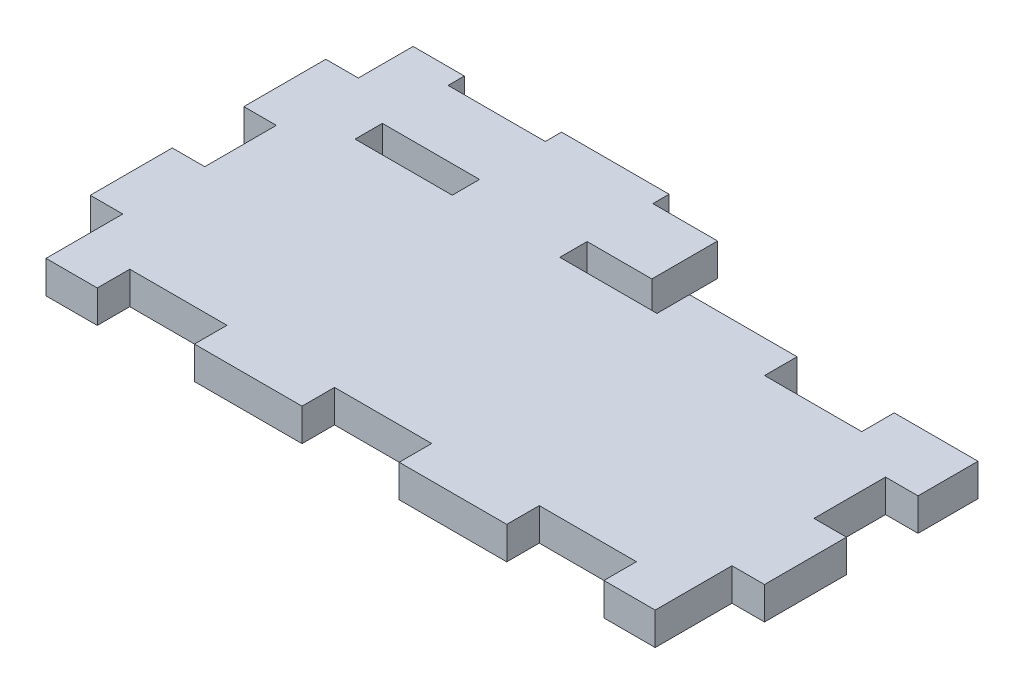
from build123d import *

# Parameters (mm, degrees)
SKETCH1_W           = 65.35
SKETCH1_H           = 35.35
BOSS_EXTRUDE1_DEPTH = 3.175
SKETCH2_W           = 28.175
SKETCH2_H           = 7.5
CUT_EXTRUDE1_DEPTH  = 75.366159138
SKETCH3_W           = 3.175
SKETCH3_H           = 7.5
SKETCH3_W_2         = 10
SKETCH3_H_2         = 3.175
SKETCH3_H_3         = 1.5875
SKETCH3_H_4         = 5.35
CUT_EXTRUDE2_DEPTH  = 3.175
SKETCH6_W           = 9.492
SKETCH6_H           = 2.667
BOSS_EXTRUDE2_DEPTH = 3.175


with BuildPart() as part:
    # Sketch1 → Boss-Extrude1 (new body)
    with BuildSketch(Plane(origin=(0, 0, 0), x_dir=(1, 0, 0), z_dir=(0, 1, 0))):
        with Locations((32.675, 17.675)):
            Rectangle(SKETCH1_W, SKETCH1_H)
    extrude(amount=BOSS_EXTRUDE1_DEPTH)

    # Sketch2 → Cut-Extrude1 (cut, through all)
    with BuildSketch(Plane.XZ):
        with Locations((51.2625, -31.6)):
            Rectangle(SKETCH2_W, SKETCH2_H)
    extrude(amount=-CUT_EXTRUDE1_DEPTH, mode=Mode.SUBTRACT)

    # Sketch3 → Cut-Extrude2 (cut)
    with BuildSketch(Plane.XZ):
        with Locations((63.7625, -3.75)):
            Rectangle(SKETCH3_W, SKETCH3_H)
        with Locations((63.7625, -18.75)):
            Rectangle(SKETCH3_W, SKETCH3_H)
        with Locations((52.675, -1.5875)):
            Rectangle(SKETCH3_W_2, SKETCH3_H_2)
        with Locations((32.675, -1.5875)):
            Rectangle(SKETCH3_W_2, SKETCH3_H_2)
        with Locations((52.675, -26.2625)):
            Rectangle(SKETCH3_W_2, SKETCH3_H_2)
        with Locations((12.675, -1.5875)):
            Rectangle(SKETCH3_W_2, SKETCH3_H_2)
        Polygon((37.175, -27.85), (37.675, -27.85), (37.675, -24.675), (27.675, -24.675), (27.675, -27.85), (34, -27.85), (34, -33.7625), (27.675, -33.7625), (27.675, -35.35), (37.175, -35.35), align=None)
        with Locations((1.5875, -3.75)):
            Rectangle(SKETCH3_W, SKETCH3_H)
        with Locations((1.5875, -18.75)):
            Rectangle(SKETCH3_W, SKETCH3_H)
        with Locations((12.675, -34.55625)):
            Rectangle(SKETCH3_W_2, SKETCH3_H_3)
        with Locations((1.5875, -32.675)):
            Rectangle(SKETCH3_W, SKETCH3_H_4)
        with Locations((12.675, -26.2625)):
            Rectangle(SKETCH3_W_2, SKETCH3_H_2)
    extrude(amount=-CUT_EXTRUDE2_DEPTH, mode=Mode.SUBTRACT)

    # Sketch6 → Boss-Extrude2 (add)
    with BuildSketch(Plane(origin=(0, 3.175, 0), x_dir=(1, 0, 0), z_dir=(0, 1, 0))):
        Polygon((7.929, -0.254), (7.929, 2.921), (17.421, 2.921), (17.421, -0.254), (27.929, -0.254), (27.929, 2.921), (37.421, 2.921), (37.421, -0.254), (47.929, -0.254), (47.929, 2.921), (57.421, 2.921), (57.421, -0.254), (62.429, -0.254), (62.429, 7.246), (65.604, 7.246), (65.604, 15.254), (62.429, 15.254), (62.429, 22.246), (65.604, 22.246), (65.604, 28.104), (57.421, 28.104), (57.421, 24.929), (47.929, 24.929), (47.929, 28.104), (37.421, 28.104), (37.421, 24.929), (27.929, 24.929), (27.929, 27.596), (34.254, 27.596), (34.254, 34.0165), (27.929, 34.0165), (27.929, 35.604), (17.421, 35.604), (17.421, 34.0165), (7.929, 34.0165), (7.929, 35.604), (2.921, 35.604), (2.921, 30.254), (-0.254, 30.254), (-0.254, 22.246), (2.921, 22.246), (2.921, 15.254), (-0.254, 15.254), (-0.254, 7.246), (2.921, 7.246), (2.921, -0.254), align=None)
        with Locations((12.675, 26.2625)):
            Rectangle(SKETCH6_W, SKETCH6_H, mode=Mode.SUBTRACT)
    extrude(amount=-BOSS_EXTRUDE2_DEPTH)


solid = part.part
